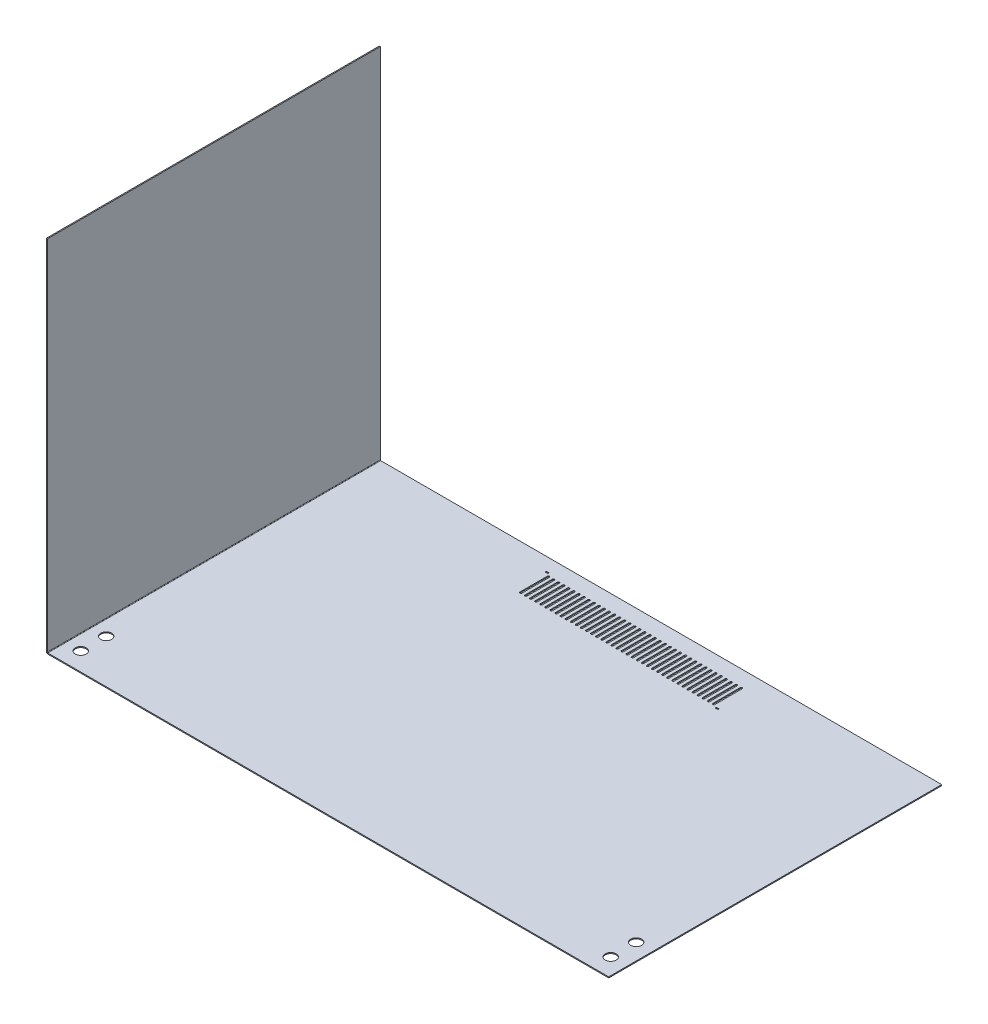
from build123d import *

# Parameters (mm, degrees)
SKETCH_1_W                       = 1108
SKETCH_1_H                       = 656
SM_BASE_FLANGE_1_DEPTH           = 2
SM_EDGE_FLANGE_1_STRIP_W         = 10
SM_EDGE_FLANGE_1_STRIP_H         = 2
SM_EDGE_FLANGE_1_STRIP_CUT_DEPTH = 656
SM_EDGE_FLANGE_1_DEPTH           = 656
SKETCH_21_R                      = 10.75
CUT_EXTRUDE_2_DEPTH              = 2


# Sheet-metal steps are written as plain solids
with BuildPart() as part:
    # Sketch 1 → Базовая кромка1 (new body)
    with BuildSketch(Plane(origin=(0, 0, 0), x_dir=(1, 0, 0), z_dir=(0, 1, 0))):
        with Locations((554, 328)):
            Rectangle(SKETCH_1_W, SKETCH_1_H)
    extrude(amount=-SM_BASE_FLANGE_1_DEPTH)

    # Ребро-кромка1 strip (across the edge) → Ребро-кромка1 strip cut (cut)
    with BuildSketch(Plane.XY.offset(-656)):
        with Locations((-2, -1)):
            Rectangle(SM_EDGE_FLANGE_1_STRIP_W, SM_EDGE_FLANGE_1_STRIP_H)
    extrude(amount=SM_EDGE_FLANGE_1_STRIP_CUT_DEPTH, mode=Mode.SUBTRACT)

    # Ребро-кромка1 section (across the edge) → Ребро-кромка1 (add)
    with BuildSketch(Plane.XY.offset(-656)):
        with BuildLine():
            Line((0, 1), (0, 706))
            Line((0, 706), (2, 706))
            Line((2, 706), (2, 1))
            ThreePointArc((2, 1), (2.292893219, 0.292893219), (3, 0))
            Line((3, 0), (3, -2))
            ThreePointArc((3, -2), (0.878679656, -1.121320344), (0, 1))
        make_face()
    extrude(amount=SM_EDGE_FLANGE_1_DEPTH)

    # Эскиз21 → Вырез-Вытянуть2 (cut)
    with BuildSketch(Plane.XZ.offset(2)):
        with Locations(Location((32, -36, 0), (0, 0, 270))):
            Circle(SKETCH_21_R)
        with Locations(Location((32, -86, 0), (0, 0, 270))):
            Circle(SKETCH_21_R)
        with Locations(Location((1076, -86, 0), (0, 0, 90))):
            Circle(SKETCH_21_R)
        with Locations(Location((1076, -36, 0), (0, 0, 90))):
            Circle(SKETCH_21_R)
        with BuildLine():
            Line((744, -623), (744, -569))
            ThreePointArc((744, -569), (746, -567), (748, -569))
            Line((748, -569), (748, -623))
            ThreePointArc((748, -623), (746, -625), (744, -623))
        make_face()
        with BuildLine():
            Line((734, -623), (734, -569))
            ThreePointArc((734, -569), (736, -567), (738, -569))
            Line((738, -569), (738, -623))
            ThreePointArc((738, -623), (736, -625), (734, -623))
        make_face()
        with BuildLine():
            Line((724, -623), (724, -569))
            ThreePointArc((724, -569), (726, -567), (728, -569))
            Line((728, -569), (728, -623))
            ThreePointArc((728, -623), (726, -625), (724, -623))
        make_face()
        with BuildLine():
            Line((714, -623), (714, -569))
            ThreePointArc((714, -569), (716, -567), (718, -569))
            Line((718, -569), (718, -623))
            ThreePointArc((718, -623), (716, -625), (714, -623))
        make_face()
        with BuildLine():
            Line((704, -623), (704, -569))
            ThreePointArc((704, -569), (706, -567), (708, -569))
            Line((708, -569), (708, -623))
            ThreePointArc((708, -623), (706, -625), (704, -623))
        make_face()
        with BuildLine():
            Line((694, -623), (694, -569))
            ThreePointArc((694, -569), (696, -567), (698, -569))
            Line((698, -569), (698, -623))
            ThreePointArc((698, -623), (696, -625), (694, -623))
        make_face()
        with BuildLine():
            Line((684, -623), (684, -569))
            ThreePointArc((684, -569), (686, -567), (688, -569))
            Line((688, -569), (688, -623))
            ThreePointArc((688, -623), (686, -625), (684, -623))
        make_face()
        with BuildLine():
            Line((674, -623), (674, -569))
            ThreePointArc((674, -569), (676, -567), (678, -569))
            Line((678, -569), (678, -623))
            ThreePointArc((678, -623), (676, -625), (674, -623))
        make_face()
        with BuildLine():
            Line((664, -623), (664, -569))
            ThreePointArc((664, -569), (666, -567), (668, -569))
            Line((668, -569), (668, -623))
            ThreePointArc((668, -623), (666, -625), (664, -623))
        make_face()
        with BuildLine():
            Line((654, -623), (654, -569))
            ThreePointArc((654, -569), (656, -567), (658, -569))
            Line((658, -569), (658, -623))
            ThreePointArc((658, -623), (656, -625), (654, -623))
        make_face()
        with BuildLine():
            Line((644, -623), (644, -569))
            ThreePointArc((644, -569), (646, -567), (648, -569))
            Line((648, -569), (648, -623))
            ThreePointArc((648, -623), (646, -625), (644, -623))
        make_face()
        with BuildLine():
            Line((634, -623), (634, -569))
            ThreePointArc((634, -569), (636, -567), (638, -569))
            Line((638, -569), (638, -623))
            ThreePointArc((638, -623), (636, -625), (634, -623))
        make_face()
        with BuildLine():
            Line((624, -623), (624, -569))
            ThreePointArc((624, -569), (626, -567), (628, -569))
            Line((628, -569), (628, -623))
            ThreePointArc((628, -623), (626, -625), (624, -623))
        make_face()
        with BuildLine():
            Line((614, -623), (614, -569))
            ThreePointArc((614, -569), (616, -567), (618, -569))
            Line((618, -569), (618, -623))
            ThreePointArc((618, -623), (616, -625), (614, -623))
        make_face()
        with BuildLine():
            Line((604, -623), (604, -569))
            ThreePointArc((604, -569), (606, -567), (608, -569))
            Line((608, -569), (608, -623))
            ThreePointArc((608, -623), (606, -625), (604, -623))
        make_face()
        with BuildLine():
            Line((594, -623), (594, -569))
            ThreePointArc((594, -569), (596, -567), (598, -569))
            Line((598, -569), (598, -623))
            ThreePointArc((598, -623), (596, -625), (594, -623))
        make_face()
        with BuildLine():
            Line((584, -623), (584, -569))
            ThreePointArc((584, -569), (586, -567), (588, -569))
            Line((588, -569), (588, -623))
            ThreePointArc((588, -623), (586, -625), (584, -623))
        make_face()
        with BuildLine():
            Line((574, -623), (574, -569))
            ThreePointArc((574, -569), (576, -567), (578, -569))
            Line((578, -569), (578, -623))
            ThreePointArc((578, -623), (576, -625), (574, -623))
        make_face()
        with BuildLine():
            Line((564, -623), (564, -569))
            ThreePointArc((564, -569), (566, -567), (568, -569))
            Line((568, -569), (568, -623))
            ThreePointArc((568, -623), (566, -625), (564, -623))
        make_face()
        with BuildLine():
            Line((554, -623), (554, -569))
            ThreePointArc((554, -569), (556, -567), (558, -569))
            Line((558, -569), (558, -623))
            ThreePointArc((558, -623), (556, -625), (554, -623))
        make_face()
        with BuildLine():
            Line((544, -623), (544, -569))
            ThreePointArc((544, -569), (546, -567), (548, -569))
            Line((548, -569), (548, -623))
            ThreePointArc((548, -623), (546, -625), (544, -623))
        make_face()
        with BuildLine():
            Line((534, -623), (534, -569))
            ThreePointArc((534, -569), (536, -567), (538, -569))
            Line((538, -569), (538, -623))
            ThreePointArc((538, -623), (536, -625), (534, -623))
        make_face()
        with BuildLine():
            Line((524, -623), (524, -569))
            ThreePointArc((524, -569), (526, -567), (528, -569))
            Line((528, -569), (528, -623))
            ThreePointArc((528, -623), (526, -625), (524, -623))
        make_face()
        with BuildLine():
            Line((514, -623), (514, -569))
            ThreePointArc((514, -569), (516, -567), (518, -569))
            Line((518, -569), (518, -623))
            ThreePointArc((518, -623), (516, -625), (514, -623))
        make_face()
        with BuildLine():
            Line((504, -623), (504, -569))
            ThreePointArc((504, -569), (506, -567), (508, -569))
            Line((508, -569), (508, -623))
            ThreePointArc((508, -623), (506, -625), (504, -623))
        make_face()
        with BuildLine():
            Line((494, -623), (494, -569))
            ThreePointArc((494, -569), (496, -567), (498, -569))
            Line((498, -569), (498, -623))
            ThreePointArc((498, -623), (496, -625), (494, -623))
        make_face()
        with BuildLine():
            Line((484, -623), (484, -569))
            ThreePointArc((484, -569), (486, -567), (488, -569))
            Line((488, -569), (488, -623))
            ThreePointArc((488, -623), (486, -625), (484, -623))
        make_face()
        with BuildLine():
            Line((474, -623), (474, -569))
            ThreePointArc((474, -569), (476, -567), (478, -569))
            Line((478, -569), (478, -623))
            ThreePointArc((478, -623), (476, -625), (474, -623))
        make_face()
        with BuildLine():
            Line((464, -623), (464, -569))
            ThreePointArc((464, -569), (466, -567), (468, -569))
            Line((468, -569), (468, -623))
            ThreePointArc((468, -623), (466, -625), (464, -623))
        make_face()
        with BuildLine():
            Line((454, -623), (454, -569))
            ThreePointArc((454, -569), (456, -567), (458, -569))
            Line((458, -569), (458, -623))
            ThreePointArc((458, -623), (456, -625), (454, -623))
        make_face()
        with BuildLine():
            Line((444, -623), (444, -569))
            ThreePointArc((444, -569), (446, -567), (448, -569))
            Line((448, -569), (448, -623))
            ThreePointArc((448, -623), (446, -625), (444, -623))
        make_face()
        with BuildLine():
            Line((434, -623), (434, -569))
            ThreePointArc((434, -569), (436, -567), (438, -569))
            Line((438, -569), (438, -623))
            ThreePointArc((438, -623), (436, -625), (434, -623))
        make_face()
        with BuildLine():
            Line((424, -623), (424, -569))
            ThreePointArc((424, -569), (426, -567), (428, -569))
            Line((428, -569), (428, -623))
            ThreePointArc((428, -623), (426, -625), (424, -623))
        make_face()
        with BuildLine():
            Line((414, -623), (414, -569))
            ThreePointArc((414, -569), (416, -567), (418, -569))
            Line((418, -569), (418, -623))
            ThreePointArc((418, -623), (416, -625), (414, -623))
        make_face()
        with BuildLine():
            Line((404, -623), (404, -569))
            ThreePointArc((404, -569), (406, -567), (408, -569))
            Line((408, -569), (408, -623))
            ThreePointArc((408, -623), (406, -625), (404, -623))
        make_face()
        with BuildLine():
            Line((394, -623), (394, -569))
            ThreePointArc((394, -569), (396, -567), (398, -569))
            Line((398, -569), (398, -623))
            ThreePointArc((398, -623), (396, -625), (394, -623))
        make_face()
        with BuildLine():
            Line((384, -623), (384, -569))
            ThreePointArc((384, -569), (386, -567), (388, -569))
            Line((388, -569), (388, -623))
            ThreePointArc((388, -623), (386, -625), (384, -623))
        make_face()
        with BuildLine():
            Line((374, -623), (374, -569))
            ThreePointArc((374, -569), (376, -567), (378, -569))
            Line((378, -569), (378, -623))
            ThreePointArc((378, -623), (376, -625), (374, -623))
        make_face()
        with BuildLine():
            Line((364, -623), (364, -569))
            ThreePointArc((364, -569), (366, -567), (368, -569))
            Line((368, -569), (368, -623))
            ThreePointArc((368, -623), (366, -625), (364, -623))
        make_face()
        with BuildLine():
            Line((356.067140259, -628.091357297), (359.067140259, -628.196119606))
            ThreePointArc((359.067140259, -628.196119606), (360.224529855, -629.437267994), (358.983381467, -630.59465759))
            Line((358.983381467, -630.59465759), (355.983381467, -630.489895282))
            ThreePointArc((355.983381467, -630.489895282), (354.825991871, -629.248746894), (356.067140259, -628.091357297))
        make_face()
        with BuildLine():
            Line((755.564909077, -563.494277567), (758.564909077, -563.599039875))
            ThreePointArc((758.564909077, -563.599039875), (759.722298673, -564.840188264), (758.481150285, -565.99757786))
            Line((758.481150285, -565.99757786), (755.481150285, -565.892815552))
            ThreePointArc((755.481150285, -565.892815552), (754.323760688, -564.651667163), (755.564909077, -563.494277567))
        make_face()
    extrude(amount=-CUT_EXTRUDE_2_DEPTH, mode=Mode.SUBTRACT)


solid = part.part
